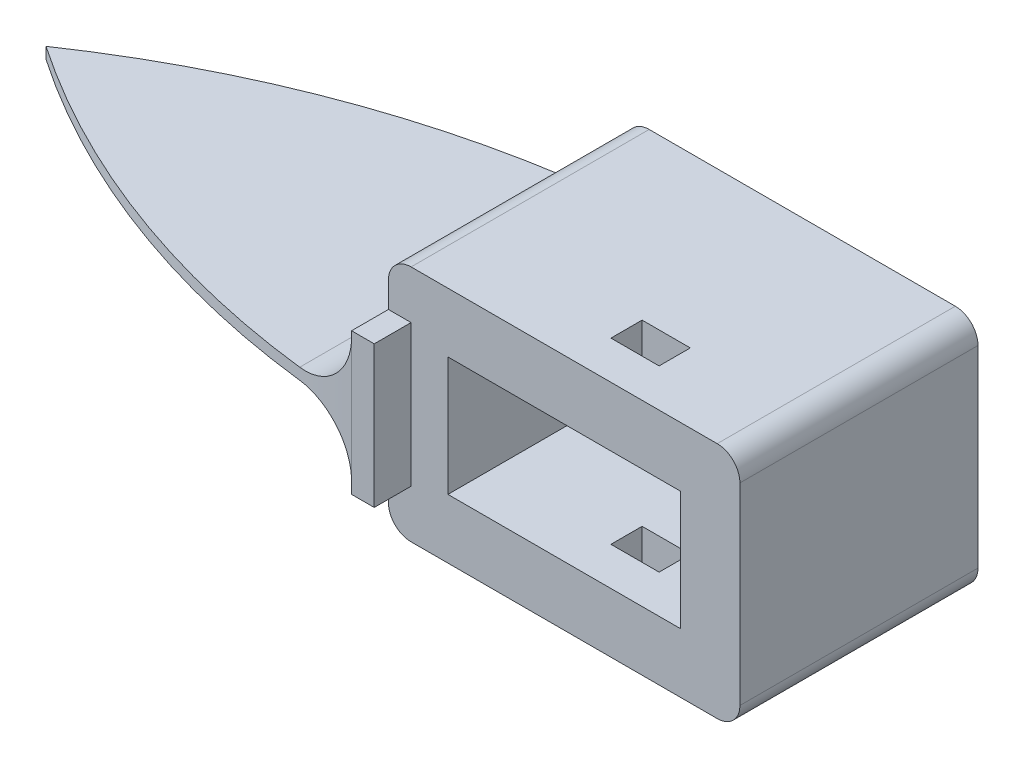
from build123d import *

# Parameters (mm, degrees)
SKETCH1_W           = 62
SKETCH1_H           = 42
SKETCH1_W_2         = 41
SKETCH1_H_2         = 21
BOSS_EXTRUDE1_DEPTH = 42
SKETCH2_W           = 4
SKETCH2_H           = 25
BOSS_EXTRUDE2_DEPTH = 4.5
SKETCH2_2_W         = 4
SKETCH2_2_H         = 25
BOSS_EXTRUDE3_DEPTH = 45.55
SKETCH3_W           = 4
SKETCH3_H           = 25
BOSS_EXTRUDE6_DEPTH = 2
BOSS_EXTRUDE7_START = -53
SKETCH3_8_W         = 4
SKETCH3_8_H         = 25
BOSS_EXTRUDE7_DEPTH = 53
CUT_EXTRUDE1_START  = -51
CUT_EXTRUDE1_DEPTH  = 51
SKETCH_1_W          = 8.5
SKETCH_1_H          = 5.5
CUT_EXTRUDE_1_DEPTH = 42
FILLET_3_R          = 4
FILLET_4_R          = 4
FILLET_5_R          = 4
FILLET_6_R          = 4
CUT_EXTRUDE3_DEPTH  = 55
BOSS_EXTRUDE8_DEPTH = 21.5
CUT_EXTRUDE4_DEPTH  = 19.5
FILLET_START        = -14.636072995
FILLET_7_DEPTH      = 10.0000001
FILLET_START_2      = -8
FILLET_7_2_DEPTH    = 57
FILLET_8_R          = 10


with BuildPart() as part:
    # Sketch1 → Boss-Extrude1 (new body)
    with BuildSketch(Plane.XY):
        with Locations((1.904162196, -4.136072895)):
            Rectangle(SKETCH1_W, SKETCH1_H)
        with Locations((1.904162196, -4.136072895)):
            Rectangle(SKETCH1_W_2, SKETCH1_H_2, mode=Mode.SUBTRACT)
    extrude(amount=BOSS_EXTRUDE1_DEPTH)

    # Sketch2 → Boss-Extrude2 (add)
    with BuildSketch(Plane.XY.offset(42)):
        with Locations((-27.095837804, -4.136072895)):
            Rectangle(SKETCH2_W, SKETCH2_H)
    extrude(amount=BOSS_EXTRUDE2_DEPTH)

    # Sketch2<2> → Boss-Extrude3 (add)
    with BuildSketch(Plane.XY.offset(42)):
        with Locations((-27.095837804, -4.136072895)):
            Rectangle(SKETCH2_2_W, SKETCH2_2_H)
    extrude(amount=-BOSS_EXTRUDE3_DEPTH)

    # Sketch3 → Boss-Extrude6 (add)
    # profile 1 of 3: a face of its own
    with BuildSketch(Plane.XY.offset(46.5)):
        with BuildLine():
            Line((-60.095837804, 4.463927105), (-60.095837804, 8.363927105))
            ThreePointArc((-60.095837804, 8.363927105), (-72.595837804, -4.136072895), (-60.095837804, -16.636072895))
            Line((-60.095837804, -16.636072895), (-60.095837804, -13.176248856))
            Line((-60.095837804, -13.176248856), (-60.555926168, -13.176248856))
            ThreePointArc((-60.555926168, -13.176248856), (-62.055926168, -11.676248856), (-60.555926168, -10.176248856))
            Line((-60.555926168, -10.176248856), (-60.095837804, -10.176248856))
            Line((-60.095837804, -10.176248856), (-60.095837804, -8.186072895))
            ThreePointArc((-60.095837804, -8.186072895), (-64.145837804, -4.136072895), (-60.095837804, -0.086072895))
            Line((-60.095837804, -0.086072895), (-60.095837804, 1.463927105))
            Line((-60.095837804, 1.463927105), (-60.595837804, 1.463927105))
            ThreePointArc((-60.595837804, 1.463927105), (-62.095837804, 2.963927105), (-60.595837804, 4.463927105))
            Line((-60.595837804, 4.463927105), (-60.095837804, 4.463927105))
        make_face()
        with BuildLine():
            ThreePointArc((-68.695837804, -3.636072895), (-67.195837804, -2.136072895), (-65.695837804, -3.636072895))
            Line((-65.695837804, -3.636072895), (-65.695837804, -4.636072895))
            ThreePointArc((-65.695837804, -4.636072895), (-67.195837804, -6.136072895), (-68.695837804, -4.636072895))
            Line((-68.695837804, -4.636072895), (-68.695837804, -3.636072895))
        make_face(mode=Mode.SUBTRACT)
    # profile 2 of 3: a face of its own
    with BuildSketch(Plane.XY.offset(46.5)):
        with BuildLine():
            Line((-29.095837804, -16.636072895), (-29.095837804, 8.363927105))
            Line((-29.095837804, 8.363927105), (-60.095837804, 8.363927105))
            Line((-60.095837804, 8.363927105), (-60.095837804, 4.463927105))
            Line((-60.095837804, 4.463927105), (-59.595837804, 4.463927105))
            ThreePointArc((-59.595837804, 4.463927105), (-58.095837804, 2.963927105), (-59.595837804, 1.463927105))
            Line((-59.595837804, 1.463927105), (-60.095837804, 1.463927105))
            Line((-60.095837804, 1.463927105), (-60.095837804, -0.086072895))
            ThreePointArc((-60.095837804, -0.086072895), (-57.23205534, -1.272290432), (-56.045837804, -4.136072895))
            ThreePointArc((-56.045837804, -4.136072895), (-57.23205534, -6.999855359), (-60.095837804, -8.186072895))
            Line((-60.095837804, -8.186072895), (-60.095837804, -10.176248856))
            Line((-60.095837804, -10.176248856), (-59.635749439, -10.176248856))
            ThreePointArc((-59.635749439, -10.176248856), (-58.135749439, -11.676248856), (-59.635749439, -13.176248856))
            Line((-59.635749439, -13.176248856), (-60.095837804, -13.176248856))
            Line((-60.095837804, -13.176248856), (-60.095837804, -16.636072895))
            Line((-60.095837804, -16.636072895), (-29.095837804, -16.636072895))
        make_face()
        with BuildLine():
            ThreePointArc((-54.495837804, -3.636072895), (-52.995837804, -2.136072895), (-51.495837804, -3.636072895))
            Line((-51.495837804, -3.636072895), (-51.495837804, -4.636072895))
            ThreePointArc((-51.495837804, -4.636072895), (-52.995837804, -6.136072895), (-54.495837804, -4.636072895))
            Line((-54.495837804, -4.636072895), (-54.495837804, -3.636072895))
        make_face(mode=Mode.SUBTRACT)
    # profile 3 of 3: a face of its own
    with BuildSketch(Plane.XY.offset(46.5)):
        with Locations((-27.095837804, -4.136072895)):
            Rectangle(SKETCH3_W, SKETCH3_H)
    extrude(amount=BOSS_EXTRUDE6_DEPTH)

    # Sketch3<8> → Boss-Extrude7 (add)
    # profile 1 of 3: a face of its own
    with BuildSketch(Plane.XY.offset(46.5).offset(BOSS_EXTRUDE7_START)):
        with BuildLine():
            Line((-60.095837804, 4.463927105), (-60.095837804, 8.363927105))
            ThreePointArc((-60.095837804, 8.363927105), (-72.595837804, -4.136072895), (-60.095837804, -16.636072895))
            Line((-60.095837804, -16.636072895), (-60.095837804, -13.176248856))
            Line((-60.095837804, -13.176248856), (-60.555926168, -13.176248856))
            ThreePointArc((-60.555926168, -13.176248856), (-62.055926168, -11.676248856), (-60.555926168, -10.176248856))
            Line((-60.555926168, -10.176248856), (-60.095837804, -10.176248856))
            Line((-60.095837804, -10.176248856), (-60.095837804, -8.186072895))
            ThreePointArc((-60.095837804, -8.186072895), (-64.145837804, -4.136072895), (-60.095837804, -0.086072895))
            Line((-60.095837804, -0.086072895), (-60.095837804, 1.463927105))
            Line((-60.095837804, 1.463927105), (-60.595837804, 1.463927105))
            ThreePointArc((-60.595837804, 1.463927105), (-62.095837804, 2.963927105), (-60.595837804, 4.463927105))
            Line((-60.595837804, 4.463927105), (-60.095837804, 4.463927105))
        make_face()
        with BuildLine():
            ThreePointArc((-68.695837804, -3.636072895), (-67.195837804, -2.136072895), (-65.695837804, -3.636072895))
            Line((-65.695837804, -3.636072895), (-65.695837804, -4.636072895))
            ThreePointArc((-65.695837804, -4.636072895), (-67.195837804, -6.136072895), (-68.695837804, -4.636072895))
            Line((-68.695837804, -4.636072895), (-68.695837804, -3.636072895))
        make_face(mode=Mode.SUBTRACT)
    # profile 2 of 3: a face of its own
    with BuildSketch(Plane.XY.offset(46.5).offset(BOSS_EXTRUDE7_START)):
        with BuildLine():
            Line((-29.095837804, -16.636072895), (-29.095837804, 8.363927105))
            Line((-29.095837804, 8.363927105), (-60.095837804, 8.363927105))
            Line((-60.095837804, 8.363927105), (-60.095837804, 4.463927105))
            Line((-60.095837804, 4.463927105), (-59.595837804, 4.463927105))
            ThreePointArc((-59.595837804, 4.463927105), (-58.095837804, 2.963927105), (-59.595837804, 1.463927105))
            Line((-59.595837804, 1.463927105), (-60.095837804, 1.463927105))
            Line((-60.095837804, 1.463927105), (-60.095837804, -0.086072895))
            ThreePointArc((-60.095837804, -0.086072895), (-57.23205534, -1.272290432), (-56.045837804, -4.136072895))
            ThreePointArc((-56.045837804, -4.136072895), (-57.23205534, -6.999855359), (-60.095837804, -8.186072895))
            Line((-60.095837804, -8.186072895), (-60.095837804, -10.176248856))
            Line((-60.095837804, -10.176248856), (-59.635749439, -10.176248856))
            ThreePointArc((-59.635749439, -10.176248856), (-58.135749439, -11.676248856), (-59.635749439, -13.176248856))
            Line((-59.635749439, -13.176248856), (-60.095837804, -13.176248856))
            Line((-60.095837804, -13.176248856), (-60.095837804, -16.636072895))
            Line((-60.095837804, -16.636072895), (-29.095837804, -16.636072895))
        make_face()
        with BuildLine():
            ThreePointArc((-54.495837804, -3.636072895), (-52.995837804, -2.136072895), (-51.495837804, -3.636072895))
            Line((-51.495837804, -3.636072895), (-51.495837804, -4.636072895))
            ThreePointArc((-51.495837804, -4.636072895), (-52.995837804, -6.136072895), (-54.495837804, -4.636072895))
            Line((-54.495837804, -4.636072895), (-54.495837804, -3.636072895))
        make_face(mode=Mode.SUBTRACT)
    # profile 3 of 3: a face of its own
    with BuildSketch(Plane.XY.offset(46.5).offset(BOSS_EXTRUDE7_START)):
        with Locations((-27.095837804, -4.136072895)):
            Rectangle(SKETCH3_8_W, SKETCH3_8_H)
    extrude(amount=BOSS_EXTRUDE7_DEPTH)

    # Sketch3<11> → Cut-Extrude1 (cut)
    # profile 1 of 2: a face of its own
    with BuildSketch(Plane.XY.offset(46.5).offset(CUT_EXTRUDE1_START)):
        with BuildLine():
            Line((-29.095837804, -16.636072895), (-29.095837804, 8.363927105))
            Line((-29.095837804, 8.363927105), (-60.095837804, 8.363927105))
            Line((-60.095837804, 8.363927105), (-60.095837804, 4.463927105))
            Line((-60.095837804, 4.463927105), (-59.595837804, 4.463927105))
            ThreePointArc((-59.595837804, 4.463927105), (-58.095837804, 2.963927105), (-59.595837804, 1.463927105))
            Line((-59.595837804, 1.463927105), (-60.095837804, 1.463927105))
            Line((-60.095837804, 1.463927105), (-60.095837804, -0.086072895))
            ThreePointArc((-60.095837804, -0.086072895), (-57.23205534, -1.272290432), (-56.045837804, -4.136072895))
            ThreePointArc((-56.045837804, -4.136072895), (-57.23205534, -6.999855359), (-60.095837804, -8.186072895))
            Line((-60.095837804, -8.186072895), (-60.095837804, -10.176248856))
            Line((-60.095837804, -10.176248856), (-59.635749439, -10.176248856))
            ThreePointArc((-59.635749439, -10.176248856), (-58.135749439, -11.676248856), (-59.635749439, -13.176248856))
            Line((-59.635749439, -13.176248856), (-60.095837804, -13.176248856))
            Line((-60.095837804, -13.176248856), (-60.095837804, -16.636072895))
            Line((-60.095837804, -16.636072895), (-29.095837804, -16.636072895))
        make_face()
        with BuildLine():
            ThreePointArc((-54.495837804, -3.636072895), (-52.995837804, -2.136072895), (-51.495837804, -3.636072895))
            Line((-51.495837804, -3.636072895), (-51.495837804, -4.636072895))
            ThreePointArc((-51.495837804, -4.636072895), (-52.995837804, -6.136072895), (-54.495837804, -4.636072895))
            Line((-54.495837804, -4.636072895), (-54.495837804, -3.636072895))
        make_face(mode=Mode.SUBTRACT)
    # profile 2 of 2: a face of its own
    with BuildSketch(Plane.XY.offset(46.5).offset(CUT_EXTRUDE1_START)):
        with BuildLine():
            Line((-60.095837804, 4.463927105), (-60.095837804, 8.363927105))
            ThreePointArc((-60.095837804, 8.363927105), (-72.595837804, -4.136072895), (-60.095837804, -16.636072895))
            Line((-60.095837804, -16.636072895), (-60.095837804, -13.176248856))
            Line((-60.095837804, -13.176248856), (-60.555926168, -13.176248856))
            ThreePointArc((-60.555926168, -13.176248856), (-62.055926168, -11.676248856), (-60.555926168, -10.176248856))
            Line((-60.555926168, -10.176248856), (-60.095837804, -10.176248856))
            Line((-60.095837804, -10.176248856), (-60.095837804, -8.186072895))
            ThreePointArc((-60.095837804, -8.186072895), (-64.145837804, -4.136072895), (-60.095837804, -0.086072895))
            Line((-60.095837804, -0.086072895), (-60.095837804, 1.463927105))
            Line((-60.095837804, 1.463927105), (-60.595837804, 1.463927105))
            ThreePointArc((-60.595837804, 1.463927105), (-62.095837804, 2.963927105), (-60.595837804, 4.463927105))
            Line((-60.595837804, 4.463927105), (-60.095837804, 4.463927105))
        make_face()
        with BuildLine():
            ThreePointArc((-68.695837804, -3.636072895), (-67.195837804, -2.136072895), (-65.695837804, -3.636072895))
            Line((-65.695837804, -3.636072895), (-65.695837804, -4.636072895))
            ThreePointArc((-65.695837804, -4.636072895), (-67.195837804, -6.136072895), (-68.695837804, -4.636072895))
            Line((-68.695837804, -4.636072895), (-68.695837804, -3.636072895))
        make_face(mode=Mode.SUBTRACT)
    extrude(amount=CUT_EXTRUDE1_DEPTH, mode=Mode.SUBTRACT)

    # 草圖1 → 除料-伸長1 (cut)
    with BuildSketch(Plane(origin=(0, 16.863927105, 0), x_dir=(1, 0, 0), z_dir=(0, 1, 0))):
        with Locations((7.654162196, -32.5)):
            Rectangle(SKETCH_1_W, SKETCH_1_H)
    extrude(amount=-CUT_EXTRUDE_1_DEPTH, mode=Mode.SUBTRACT)

    # 圓角3
    fillet_3_edges = [part.edges().sort_by_distance(p)[0] for p in [
        (-29.095837804, 16.863927105, 21),
    ]]
    fillet(fillet_3_edges, radius=FILLET_3_R)

    # 圓角4
    fillet_4_edges = [part.edges().sort_by_distance(p)[0] for p in [
        (32.904162196, 16.863927105, 21),
    ]]
    fillet(fillet_4_edges, radius=FILLET_4_R)

    # 圓角5
    fillet_5_edges = [part.edges().sort_by_distance(p)[0] for p in [
        (32.904162196, -25.136072895, 21),
    ]]
    fillet(fillet_5_edges, radius=FILLET_5_R)

    # 圓角6
    fillet_6_edges = [part.edges().sort_by_distance(p)[0] for p in [
        (-29.095837804, -25.136072895, 21),
    ]]
    fillet(fillet_6_edges, radius=FILLET_6_R)

    # Sketch8 → Cut-Extrude3 (cut)
    with BuildSketch(Plane(origin=(0, 0, -6.5), x_dir=(-1, 0, 0), z_dir=(0, 0, -1))):
        Polygon((29.095837804, 8.363927105), (72.680638832, 8.363927105), (72.680638832, -16.742132378), (29.095837804, -16.636072895), align=None)
    extrude(amount=-CUT_EXTRUDE3_DEPTH, mode=Mode.SUBTRACT)

    # Sketch9 → Boss-Extrude8 (add)
    with BuildSketch(Plane(origin=(0, 16.863927105, 0), x_dir=(1, 0, 0), z_dir=(0, 1, 0))):
        with BuildLine():
            Line((-29.095837804, -21), (-29.095837804, 6.5))
            ThreePointArc((-29.095837804, 6.5), (-71.675454468, -1.684056641), (-110.494224033, -21))
            Line((-110.494224033, -21), (-29.095837804, -21))
        make_face()
        with BuildLine():
            Line((-29.095837804, -48.5), (-29.095837804, -21))
            Line((-29.095837804, -21), (-110.494224033, -21))
            ThreePointArc((-110.494224033, -21), (-71.675454468, -40.315943359), (-29.095837804, -48.5))
        make_face()
    extrude(amount=-BOSS_EXTRUDE8_DEPTH)

    # Sketch9<4> → Cut-Extrude4 (cut)
    with BuildSketch(Plane(origin=(0, 16.863927105, 0), x_dir=(1, 0, 0), z_dir=(0, 1, 0))):
        with BuildLine():
            Line((-29.095837804, -21), (-29.095837804, 6.5))
            ThreePointArc((-29.095837804, 6.5), (-71.675454468, -1.684056641), (-110.494224033, -21))
            Line((-110.494224033, -21), (-29.095837804, -21))
        make_face()
        with BuildLine():
            Line((-29.095837804, -48.5), (-29.095837804, -21))
            Line((-29.095837804, -21), (-110.494224033, -21))
            ThreePointArc((-110.494224033, -21), (-71.675454468, -40.315943359), (-29.095837804, -48.5))
        make_face()
    extrude(amount=-CUT_EXTRUDE4_DEPTH, mode=Mode.SUBTRACT)

    # 圓角7: read off the stored shape, not the designer's step
    # 圓角7 outline → 圓角7 (add)
    with BuildSketch(Plane(origin=(0, 0, 0), x_dir=(1, 0, 0), z_dir=(0, 1, 0)).offset(FILLET_START)):
        with BuildLine():
            ThreePointArc((-29.095837804, 6.5), (-71.675454468, -1.684056641), (-110.494224033, -21))
            ThreePointArc((-110.494224033, -21), (-71.675454468, -40.315943359), (-29.095837804, -48.5))
            Line((-29.095837804, -48.5), (-29.095837804, 6.5))
        make_face()
    extrude(amount=FILLET_7_DEPTH)

    # Fillet 7 2 outline → Fillet 7 2 (cut)
    with BuildSketch(Plane.XY.offset(FILLET_START_2)):
        with BuildLine():
            Line((-112, -14.636072995), (-29.095837804, -14.636072895))
            ThreePointArc((-29.095837804, -14.636072895), (-32.024769993, -7.565005084), (-39.095837804, -4.636072895))
            Line((-39.095837804, -4.636072895), (-112, -4.636072895))
            Line((-112, -4.636072895), (-112, -14.636072995))
        make_face()
    extrude(amount=FILLET_7_2_DEPTH, mode=Mode.SUBTRACT)

    # 圓角8
    # the kernel refuses this fillet: 10 mm, written as the material it adds along each edge
    with BuildSketch(Plane(origin=(-29.095837804, -2.636072895, 48.5), x_dir=(0, 1, 0), z_dir=(0, 0, -1))) as fillet_8_piece_1_section:
        with BuildLine():
            CenterArc((FILLET_8_R, -FILLET_8_R), FILLET_8_R, 90, 90)
            Line((0, -FILLET_8_R), (0, 0))
            Line((0, 0), (FILLET_8_R, 0))
        make_face()
    fillet_8_piece_1 = extrude(amount=55, mode=Mode.PRIVATE)
    fillet_8_piece_1 = fillet_8_piece_1 & Plane(origin=(-20.463988641, -2.636072895, 153.26699027), x_dir=(-0.053949057267824306, 0, -0.998543689189368), z_dir=(0, 1, 0)) * Cylinder(160, 150, mode=Mode.PRIVATE)
    fillet_8_piece_1 = fillet_8_piece_1 & Plane(origin=(-20.463988641, -2.636072895, -111.26699027), x_dir=(-0.5626889712033937, 0, 0.8266686891893671), z_dir=(0, 1, 0)) * Cylinder(160, 150, mode=Mode.PRIVATE)
    add(fillet_8_piece_1)


solid = part.part
